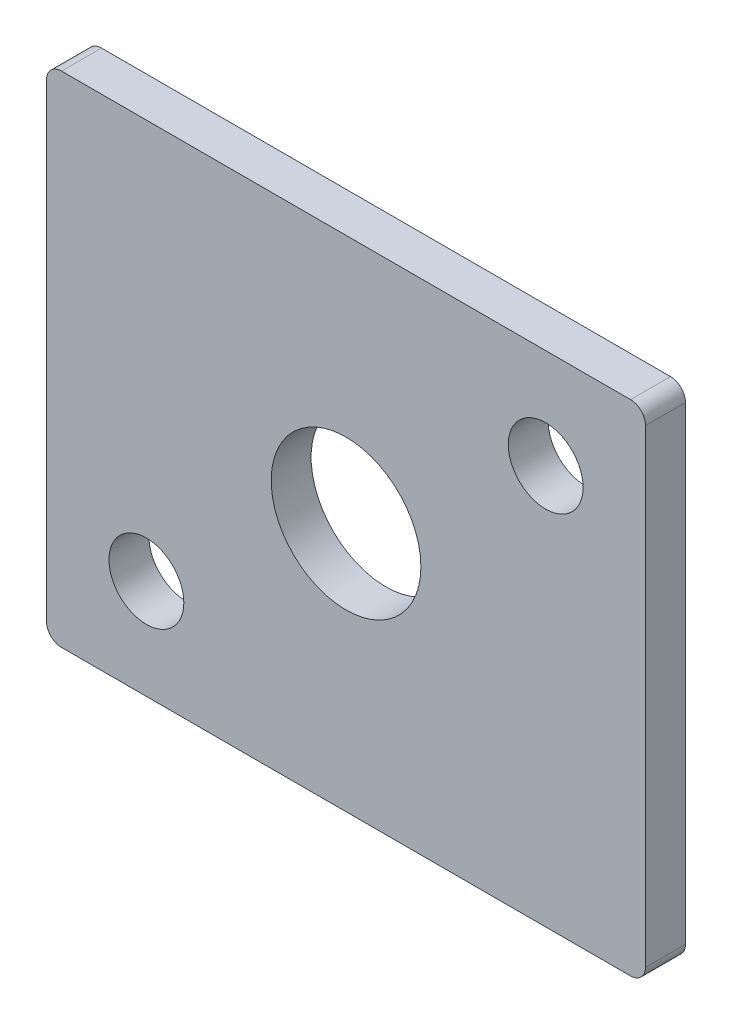
from build123d import *

# Parameters (mm, degrees)
SKIZZE1_W                       = 12
SKIZZE1_H                       = 10
AUFSATZ_LINEAR_AUSTRAGEN1_DEPTH = 0.8
SKIZZE2_R                       = 0.75
SKIZZE2_R_2                     = 1.5
SCHNITT_LINEAR_AUSTRAGEN1_DEPTH = 16.640971837
VERRUNDUNG1_R                   = 0.3


with BuildPart() as part:
    # Skizze1 → Aufsatz-Linear austragen1 (new body)
    with BuildSketch(Plane.XY):
        with Locations((6, 5)):
            Rectangle(SKIZZE1_W, SKIZZE1_H)
    extrude(amount=AUFSATZ_LINEAR_AUSTRAGEN1_DEPTH)

    # Skizze2 → Schnitt-Linear austragen1 (cut, through all)
    with BuildSketch(Plane.XY.offset(0.8)):
        with Locations((2, 2)):
            Circle(SKIZZE2_R)
        with Locations((6, 5)):
            Circle(SKIZZE2_R_2)
        with Locations((10, 8)):
            Circle(SKIZZE2_R)
    extrude(amount=-SCHNITT_LINEAR_AUSTRAGEN1_DEPTH, mode=Mode.SUBTRACT)

    # Verrundung1
    verrundung1_edges = [part.edges().sort_by_distance(p)[0] for p in [
        (0, 0, 0.4),
        (12, 0, 0.4),
        (12, 10, 0.4),
        (0, 10, 0.4),
    ]]
    fillet(verrundung1_edges, radius=VERRUNDUNG1_R)


solid = part.part
